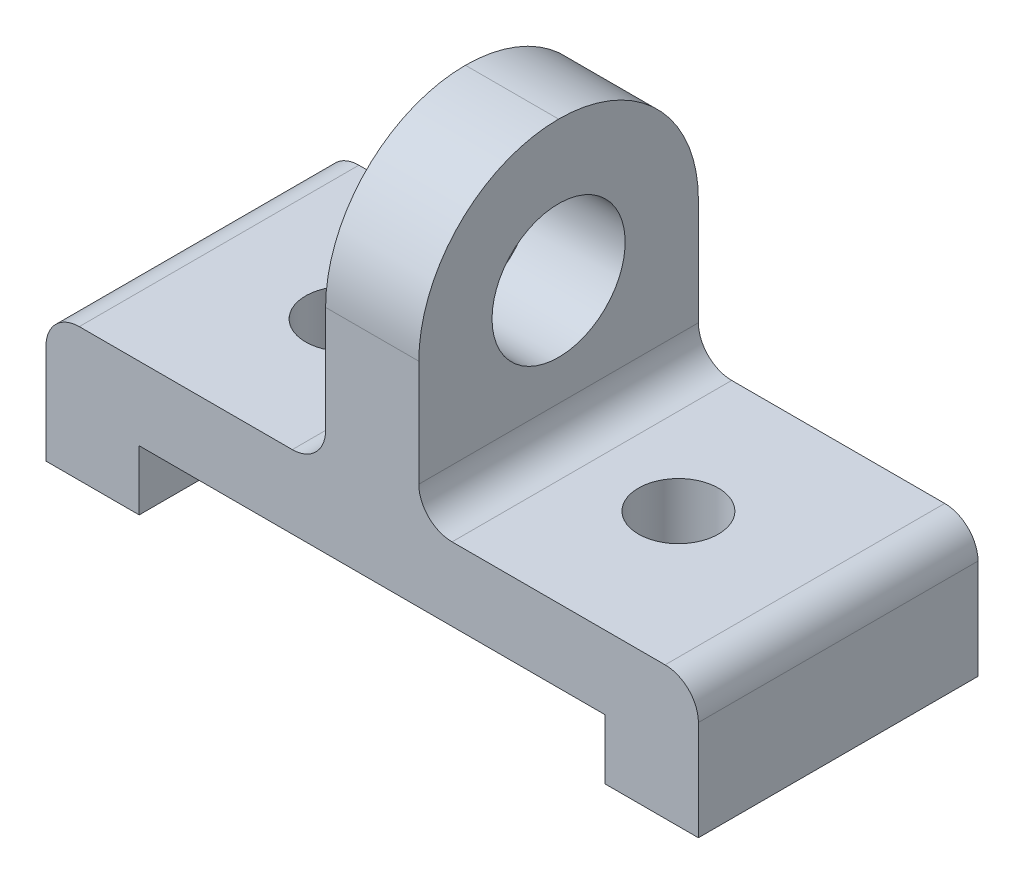
from build123d import *

# Parameters (mm, degrees)
SKETCH2_W               = 98
SKETCH2_H               = 42
BOSS_EXTRUDE1_DEPTH     = 11
SKETCH3_W               = 14
SKETCH3_H               = 42
BOSS_EXTRUDE2_DEPTH     = 9
FILLET1_R               = 5
CUT_EXTRUDE1_DEPTH      = 55.433445601
CUT_EXTRUDE1_DEPTH_BACK = 55.433445601
SKETCH4_R               = 6
SKETCH5_W               = 14
SKETCH5_H               = 42
BOSS_EXTRUDE4_DEPTH     = 53
FILLET2_R               = 21
FILLET3_R               = 5
CUT_EXTRUDE2_DEPTH      = 76.173133499
CUT_EXTRUDE2_DEPTH_BACK = 76.173133499
SKETCH6_R               = 10


with BuildPart() as part:
    # Sketch2 → Boss-Extrude1 (new body)
    with BuildSketch(Plane(origin=(0, 0, 0), x_dir=(1, 0, 0), z_dir=(0, 1, 0))):
        Rectangle(SKETCH2_W, SKETCH2_H)
    extrude(amount=BOSS_EXTRUDE1_DEPTH)

    # Sketch3 → Boss-Extrude2 (add)
    with BuildSketch(Plane(origin=(0, 0, 0), x_dir=(1, 0, 0), z_dir=(0, 1, 0))):
        with Locations((42, 0)):
            Rectangle(SKETCH3_W, SKETCH3_H)
        with Locations((-42, 0)):
            Rectangle(SKETCH3_W, SKETCH3_H)
    extrude(amount=-BOSS_EXTRUDE2_DEPTH)

    # Fillet1
    fillet1_edges = [part.edges().sort_by_distance(p)[0] for p in [
        (-49, 11, 0),
        (49, 11, 0),
    ]]
    fillet(fillet1_edges, radius=FILLET1_R)

    # Sketch4 → Cut-Extrude1 (cut, two sides: drawn at the far end of the back side and taken through both)
    with BuildSketch(Plane(origin=(0, 0, 0), x_dir=(1, 0, 0), z_dir=(0, 1, 0)).offset(-CUT_EXTRUDE1_DEPTH_BACK)):
        with Locations(Location((-25, 0, 0), (0, 0, 270))):
            Circle(SKETCH4_R)
        with Locations(Location((25, 0, 0), (0, 0, 270))):
            Circle(SKETCH4_R)
    extrude(amount=CUT_EXTRUDE1_DEPTH + CUT_EXTRUDE1_DEPTH_BACK, mode=Mode.SUBTRACT)

    # Sketch5 → Boss-Extrude4 (add)
    with BuildSketch(Plane(origin=(0, 0, 0), x_dir=(1, 0, 0), z_dir=(0, 1, 0))):
        Rectangle(SKETCH5_W, SKETCH5_H)
    extrude(amount=BOSS_EXTRUDE4_DEPTH)

    # Fillet2
    fillet2_edges = [part.edges().sort_by_distance(p)[0] for p in [
        (0, 53, -21),
        (0, 53, 21),
    ]]
    fillet(fillet2_edges, radius=FILLET2_R - 0.0001)  # a hair under: the kernel refuses the full size

    # Fillet3
    fillet3_edges = [part.edges().sort_by_distance(p)[0] for p in [
        (7, 11, 0),
        (-7, 11, 0),
    ]]
    fillet(fillet3_edges, radius=FILLET3_R)

    # Sketch6 → Cut-Extrude2 (cut, two sides: drawn at the far end of the back side and taken through both)
    with BuildSketch(Plane(origin=(0, 0, 0), x_dir=(0, 0, -1), z_dir=(1, 0, 0)).offset(-CUT_EXTRUDE2_DEPTH_BACK)):
        with Locations(Location((0, 32, 0), (0, 0, 180))):
            Circle(SKETCH6_R)
    extrude(amount=CUT_EXTRUDE2_DEPTH + CUT_EXTRUDE2_DEPTH_BACK, mode=Mode.SUBTRACT)


solid = part.part
